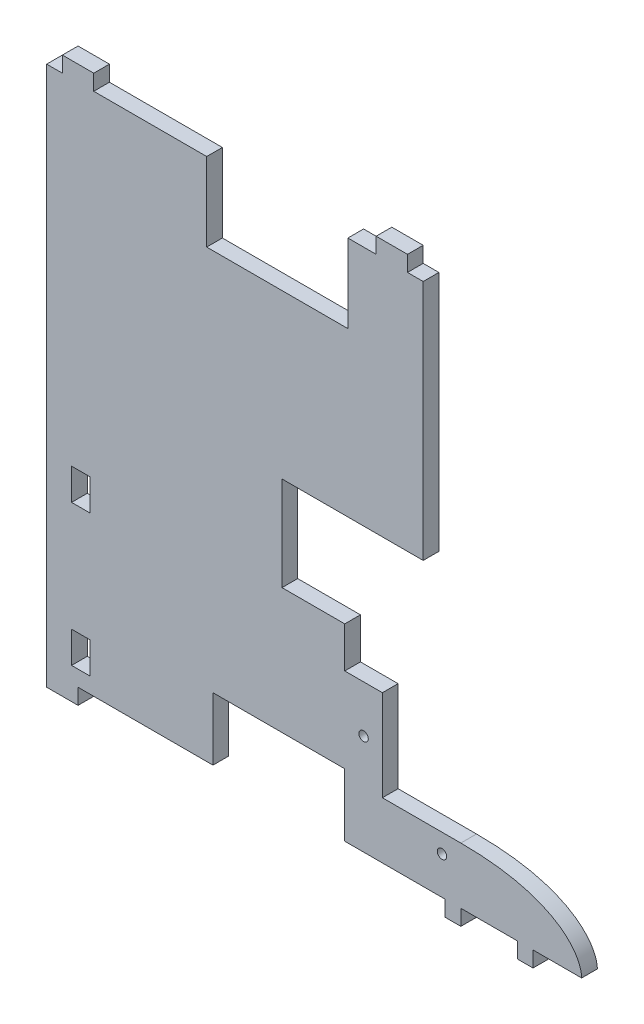
from build123d import *

# Parameters (mm, degrees)
ESQUISSE1_R        = 1.5
BOSS_EXTRU_1_DEPTH = 5
ESQUISSE2_W        = 5.906448303
ESQUISSE2_H        = 10
BOSS_EXTRU_2_DEPTH = 5


with BuildPart() as part:
    # Esquisse1 → Boss.-Extru.1 (new body)
    with BuildSketch(Plane.XY):
        Polygon((0, 0), (32, 0), (32, -5), (37, -5), (37, 0), (37, 18), (12, 18), (12, 47), (0, 47), align=None)
        with Locations((6, 32)):
            Circle(ESQUISSE1_R, mode=Mode.SUBTRACT)
        with Locations((31, 12)):
            Circle(ESQUISSE1_R, mode=Mode.SUBTRACT)
    extrude(amount=BOSS_EXTRU_1_DEPTH)

    # Esquisse2 → Boss.-Extru.2 (add)
    # profile 1 of 2: a face of its own
    with BuildSketch(Plane(origin=(0, 0, 0), x_dir=(-1, 0, 0), z_dir=(0, 0, -1))):
        with BuildLine():
            Line((-37, 0), (-55, 0))
            Line((-55, 0), (-55, -5))
            Line((-55, -5), (-60, -5))
            Line((-60, -5), (-60, 0))
            Line((-60, 0), (-75.5, 0))
            add(Edge.make_bspline(
                [(-75.5, 0), (-75.5, 5.982232529), (-67.685409636, 18), (-37, 18)],
                knots=[0, 0, 0, 0, 1, 1, 1, 1], degree=3))
            Line((-37, 18), (-37, 0))
        make_face()
    # profile 2 of 2: a face of its own
    with BuildSketch(Plane(origin=(0, 0, 0), x_dir=(-1, 0, 0), z_dir=(0, 0, -1))):
        Polygon((42, 0), (85, 0), (85, -5), (95, -5), (95, 167), (90, 167), (90, 172), (80, 172), (80, 167), (44, 167), (44, 142), (-1, 142), (-1, 167), (-10, 167), (-10, 172), (-20, 172), (-20, 167), (-25, 167), (-25, 90), (20, 90), (20, 60), (0, 60), (0, 20), (42, 20), align=None)
        with Locations((84.110232903, 55)):
            Rectangle(ESQUISSE2_W, ESQUISSE2_H, mode=Mode.SUBTRACT)
        with Locations((84.110232903, 10)):
            Rectangle(ESQUISSE2_W, ESQUISSE2_H, mode=Mode.SUBTRACT)
    extrude(amount=-BOSS_EXTRU_2_DEPTH)


solid = part.part
